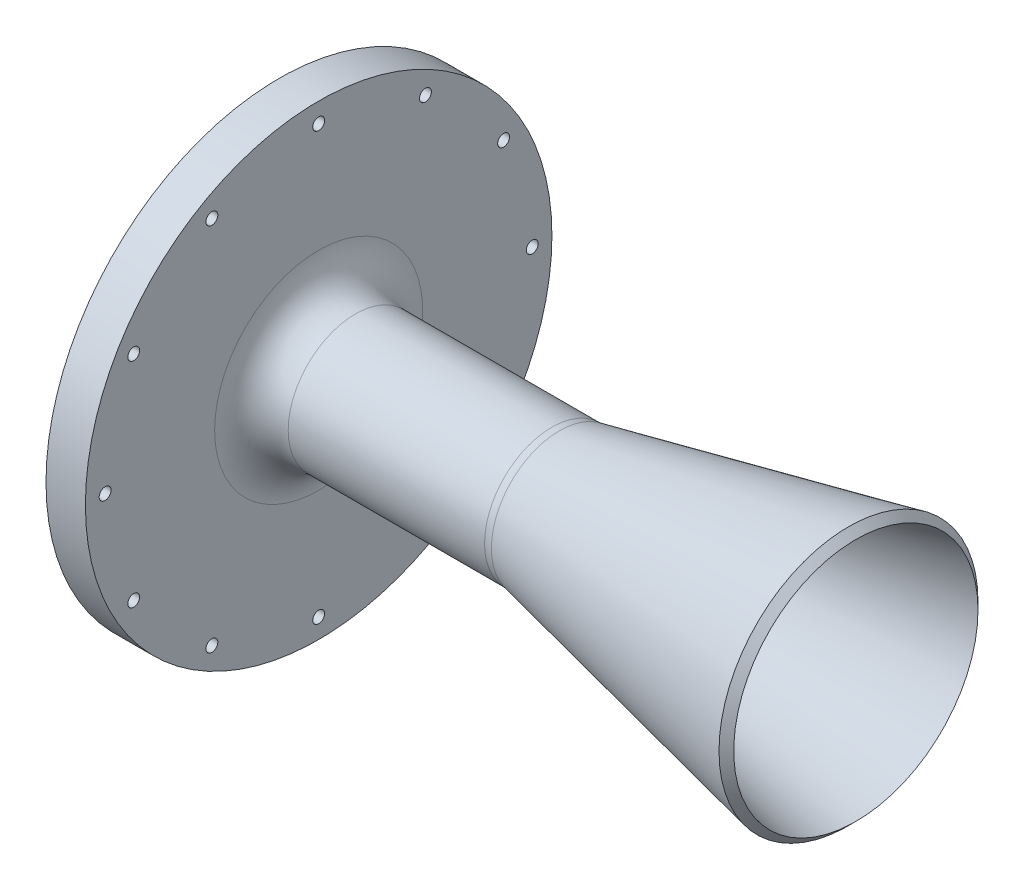
from build123d import *

# Parameters (mm, degrees)
FLANGE_HOLES_D    = 2.8702
DOWEL_HOLES_D     = 4.7625
DOWEL_HOLES_DEPTH = 6.35
DOWEL_HOLES_TIP   = 1.430799349
FILLET1_R         = 8.89
CHAMFER1_SIZE     = 2.141545552
CHAMFER1_SIZE_2   = 2.54


with BuildPart() as part:
    # Sketch2 → Main Structure (revolve)
    with BuildSketch(Plane.XY, mode=Mode.PRIVATE) as main_structure_sk:
        Polygon((0, 20.583496156), (0, 56.388), (9.525, 56.388), (9.525, 16.256), (66.806461084, 16.256), (139.7, 31.75), (139.7, 29.592458901), (60.325, 12.720781818), (60.325, 14.351), (10.795, 14.351), align=None)
    revolve(main_structure_sk.sketch.rotate(Axis((0, 0, 0), (1, 0, 0)), 90), axis=Axis((0, 0, 0), (1, 0, 0)))

    # Flange Holes (through all)
    with Locations(Plane.ZY):
        with Locations((0, -51.6255), (-25.81275, -44.708994483), (-44.708994483, -25.81275), (-51.6255, 0), (-44.708994483, 25.81275), (-25.81275, 44.708994483), (0, 51.6255), (25.81275, 44.708994483), (44.708994483, 25.81275), (51.6255, 0), (44.708994483, -25.81275), (25.81275, -44.708994483)):
            Hole(FLANGE_HOLES_D / 2)

    # Dowel Holes
    with Locations(Plane.ZY):
        with Locations((49.866403745, -13.361662613), (-49.866403745, 13.361662613)):
            Hole(DOWEL_HOLES_D / 2, depth=DOWEL_HOLES_DEPTH)
            with Locations((0, 0, -(DOWEL_HOLES_DEPTH + DOWEL_HOLES_TIP / 2))):  # 118° drill point
                Cone(0, DOWEL_HOLES_D / 2, DOWEL_HOLES_TIP, mode=Mode.SUBTRACT)

    # Fillet1
    fillet1_edges = [part.edges().sort_by_distance(p)[0] for p in [
        (66.806461084, 0, -16.256),
        (9.525, 0, -16.256),
    ]]
    fillet(fillet1_edges, radius=FILLET1_R)

    # Sketch13 → Cut-Revolve1 (revolve, cut)
    with BuildSketch(Plane(origin=(0, 0, 0), x_dir=(1, 0, 0), z_dir=(0, 1, 0)), mode=Mode.PRIVATE) as cut_revolve1_sk:
        Polygon((0, 38.1), (3.33331808, 0), (0, 0), align=None)
    revolve(cut_revolve1_sk.sketch.rotate(Axis((3.33331808, 0, 0), (-1, 0, 0)), 180), axis=Axis((3.33331808, 0, 0), (-1, 0, 0)), mode=Mode.SUBTRACT)

    # Chamfer1
    # the kernel refuses this chamfer: 3.297690964, 2.54, 2.141545552 mm, written as the material it takes off along each edge
    with BuildSketch(Plane(origin=(139.7, 0, 0), x_dir=(0, 0, 1), z_dir=(0, 1, 0))) as chamfer1_piece_1:
        Polygon((31.75 - CHAMFER1_SIZE * 0.207911690799, -CHAMFER1_SIZE * 0.978147600645), (31.75 - CHAMFER1_SIZE_2, 0), (31.75, 0), align=None)
    revolve(axis=Axis((139.7, 0, 0), (1, 0, 0)), mode=Mode.SUBTRACT)


solid = part.part
